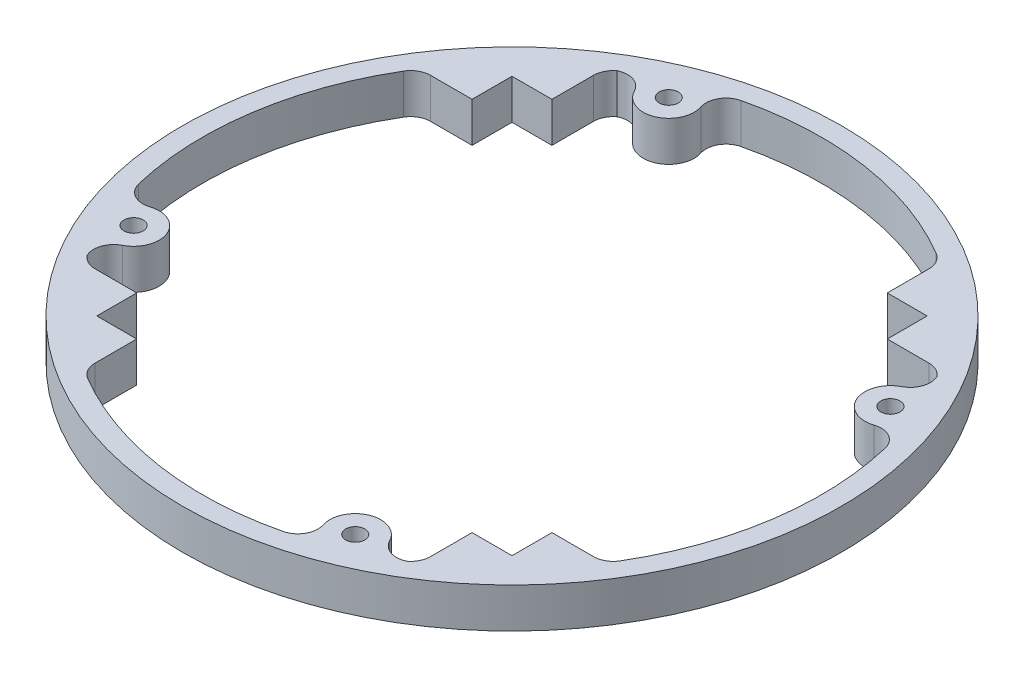
from build123d import *

# Parameters (mm, degrees)
SKETCH1_R                   = 82.55
BOSS_EXTRUDE1_DEPTH         = 10
FILLET1_R                   = 5
F_12_0_189_DIAMETER_HOLE1_D = 4.8006
CIRPATTERN1_COUNT           = 4


with BuildPart() as part:
    # Sketch1 → Boss-Extrude1 (new body)
    with BuildSketch(Plane(origin=(0, 0, 0), x_dir=(1, 0, 0), z_dir=(0, 1, 0))):
        with Locations(Location((0, 0, 0), (0, 0, 270))):
            Circle(SKETCH1_R)
        with BuildLine():
            Line((-42, 52), (-52, 52))
            Line((-52, 52), (-52, 42))
            Line((-52, 42), (-65.192043226, 42))
            ThreePointArc((-65.192043226, 42), (-74.396389201, 21.890175283), (-77.55, 0))
            ThreePointArc((-77.55, 0), (-76.61982896, -11.975153869), (-73.851629653, -23.663036524))
            Line((-73.851629653, -23.663036524), (-69.476634051, -21.85085401))
            ThreePointArc((-69.476634051, -21.85085401), (-61.114631076, -25.314509051), (-64.578286117, -33.676512026))
            Line((-64.578286117, -33.676512026), (-68.953281719, -35.48869454))
            ThreePointArc((-68.953281719, -35.48869454), (-67.151629361, -38.789962286), (-65.192043226, -42))
            Line((-65.192043226, -42), (-52, -42))
            Line((-52, -42), (-52, -52))
            Line((-52, -52), (-42, -52))
            Line((-42, -52), (-42, -65.192043226))
            ThreePointArc((-42, -65.192043226), (-21.890175283, -74.396389201), (0, -77.55))
            ThreePointArc((0, -77.55), (11.975153869, -76.61982896), (23.663036524, -73.851629653))
            Line((23.663036524, -73.851629653), (21.85085401, -69.476634051))
            ThreePointArc((21.85085401, -69.476634051), (25.314509051, -61.114631076), (33.676512026, -64.578286117))
            Line((33.676512026, -64.578286117), (35.48869454, -68.953281719))
            ThreePointArc((35.48869454, -68.953281719), (38.789962286, -67.151629361), (42, -65.192043226))
            Line((42, -65.192043226), (42, -52))
            Line((42, -52), (52, -52))
            Line((52, -52), (52, -42))
            Line((52, -42), (65.192043226, -42))
            ThreePointArc((65.192043226, -42), (74.396389201, -21.890175283), (77.55, 0))
            ThreePointArc((77.55, 0), (76.61982896, 11.975153869), (73.851629653, 23.663036524))
            Line((73.851629653, 23.663036524), (69.476634051, 21.85085401))
            ThreePointArc((69.476634051, 21.85085401), (61.114631076, 25.314509051), (64.578286117, 33.676512026))
            Line((64.578286117, 33.676512026), (68.953281719, 35.48869454))
            ThreePointArc((68.953281719, 35.48869454), (67.151629361, 38.789962286), (65.192043226, 42))
            Line((65.192043226, 42), (52, 42))
            Line((52, 42), (52, 52))
            Line((52, 52), (42, 52))
            Line((42, 52), (42, 65.192043226))
            ThreePointArc((42, 65.192043226), (21.890175283, 74.396389201), (0, 77.55))
            ThreePointArc((0, 77.55), (-11.975153869, 76.61982896), (-23.663036524, 73.851629653))
            Line((-23.663036524, 73.851629653), (-21.85085401, 69.476634051))
            ThreePointArc((-21.85085401, 69.476634051), (-25.314509051, 61.114631076), (-33.676512026, 64.578286117))
            Line((-33.676512026, 64.578286117), (-35.48869454, 68.953281719))
            ThreePointArc((-35.48869454, 68.953281719), (-38.789962286, 67.151629361), (-42, 65.192043226))
            Line((-42, 65.192043226), (-42, 52))
        make_face(mode=Mode.SUBTRACT)
    extrude(amount=BOSS_EXTRUDE1_DEPTH)

    # Fillet1
    # the kernel refuses this fillet: 5 mm, written as the material it adds along each edge
    with BuildSketch(Plane(origin=(-73.851629653, 0, 23.663036524), x_dir=(-0.269371971456704, 0, -0.9630362095962584), z_dir=(0, 1, 0)), Plane(origin=(23.663036524, 0, 73.851629653), x_dir=(-0.9630362095962577, 0, 0.26937197145670677), z_dir=(0, 1, 0)), Plane(origin=(73.851629653, 0, -23.663036524), x_dir=(0.269371971456704, 0, 0.9630362095962584), z_dir=(0, 1, 0)), Plane(origin=(-23.663036524, 0, -73.851629653), x_dir=(0.9630362095962544, 0, -0.26937197145671865), z_dir=(0, 1, 0))) as fillet1_piece_1:
        with BuildLine():
            CenterArc((5.602962852, -4.996515299), FILLET1_R, 87.860754673, 94.506173203)
            Line((0.607228677, -5.203009978), (0.107655259, -5.223659445))
            ThreePointArc((0.107655259, -5.223659445), (0.070289372, -4.761265734), (-0.496406817, -0.059835376))
            Line((-0.496406817, -0.059835376), (-0.0186641, 0.49965153))
            ThreePointArc((-0.0186641, 0.49965153), (2.894801927, 0.554047707), (5.808267953, 0.49965153))
            Line((5.808267953, 0.49965153), (5.789603853, 0))
        make_face()
    extrude(amount=10)
    with BuildSketch(Plane(origin=(-68.953281719, 0, 35.48869454), x_dir=(0.9224276908117425, 0, -0.386169852815722), z_dir=(0, 1, 0)), Plane(origin=(35.48869454, 0, 68.953281719), x_dir=(-0.38616985281572375, 0, -0.9224276908117417), z_dir=(0, 1, 0)), Plane(origin=(68.953281719, 0, -35.48869454), x_dir=(-0.9224276908117431, 0, 0.3861698528157207), z_dir=(0, 1, 0)), Plane(origin=(-35.48869454, 0, -68.953281719), x_dir=(0.3861698528157226, 0, 0.9224276908117423), z_dir=(0, 1, 0))) as fillet1_piece_2:
        with BuildLine():
            CenterArc((5.612329068, -4.985992408), FILLET1_R, 94.289787829, 94.506173203)
            Line((0.67113325, -5.75057327), (0.177013669, -5.827031356))
            ThreePointArc((0.177013669, -5.827031356), (-0.214745972, -2.939512072), (-0.498446682, -0.039381534))
            Line((-0.498446682, -0.039381534), (0.001888314, 0.499996434))
            ThreePointArc((0.001888314, 0.499996434), (4.73731566, 0.482112358), (5.200923615, 0.498599241))
            Line((5.200923615, 0.498599241), (5.238324111, 0))
        make_face()
    extrude(amount=10)
    with BuildSketch(Plane(origin=(-42, 0, 65.192043226), x_dir=(0, 0, -1), z_dir=(0, 1, 0)), Plane(origin=(65.192043226, 0, 42), x_dir=(-1, 0, 0), z_dir=(0, 1, 0)), Plane(origin=(42, 0, -65.192043226), x_dir=(0, 0, 1), z_dir=(0, 1, 0)), Plane(origin=(-65.192043226, 0, -42), x_dir=(1, 0, 0), z_dir=(0, 1, 0))) as fillet1_piece_3:
        with BuildLine():
            CenterArc((2.786093991, -5), FILLET1_R, 90, 59.336629316)
            ThreePointArc((-1.514798445, -2.450034459), (-0.768775648, -1.217983455), (0, 0))
            Line((0, 0), (2.786093991, 0))
        make_face()
    extrude(amount=10)
    with BuildSketch(Plane(origin=(-65.192043226, 0, 42), x_dir=(-0.5258802907220335, 0, -0.8505585928259789), z_dir=(0, 1, 0)), Plane(origin=(42, 0, 65.192043226), x_dir=(-0.8505585928259877, 0, 0.5258802907220195), z_dir=(0, 1, 0)), Plane(origin=(65.192043226, 0, -42), x_dir=(0.5258802907220256, 0, 0.8505585928259839), z_dir=(0, 1, 0))) as fillet1_piece_4:
        with BuildLine():
            CenterArc((2.787641046, -4.999137638), FILLET1_R, 88.935847769, 59.336629316)
            Line((-1.465151918, -2.369736184), (0, 0))
            ThreePointArc((0, 0), (1.440250254, 0.01337524), (2.880500508, 0))
        make_face()
    extrude(amount=10)
    with BuildSketch(Plane(origin=(-42, 0, -65.192043226), x_dir=(0, 0, 1), z_dir=(0, 1, 0))) as fillet1_piece_5:
        with BuildLine():
            CenterArc((2.786093991, 5), FILLET1_R, 210.663370684, 59.336629316)
            ThreePointArc((-1.514798445, 2.450034459), (-0.768775648, 1.217983455), (0, 0))
            Line((0, 0), (2.786093991, 0))
        make_face()
    extrude(amount=10)

    # #12 (0.189) Diameter Hole1 (through all)
    with Locations(Plane(origin=(0, 10, 0), x_dir=(1, 0, 0), z_dir=(0, 1, 0))):
        with Locations((67.027460084, 27.763683018)):
            f_12_0_189_diameter_hole1 = Hole(F_12_0_189_DIAMETER_HOLE1_D / 2)

    # CirPattern1: #12 (0.189) Diameter Hole1 ×4 about axis
    cirpattern1_axis = Axis((0, 0, 0), (0, 1, 0))
    for i in range(1, CIRPATTERN1_COUNT):
        add(f_12_0_189_diameter_hole1.rotate(cirpattern1_axis, i * 360 / CIRPATTERN1_COUNT), mode=Mode.SUBTRACT)


solid = part.part
